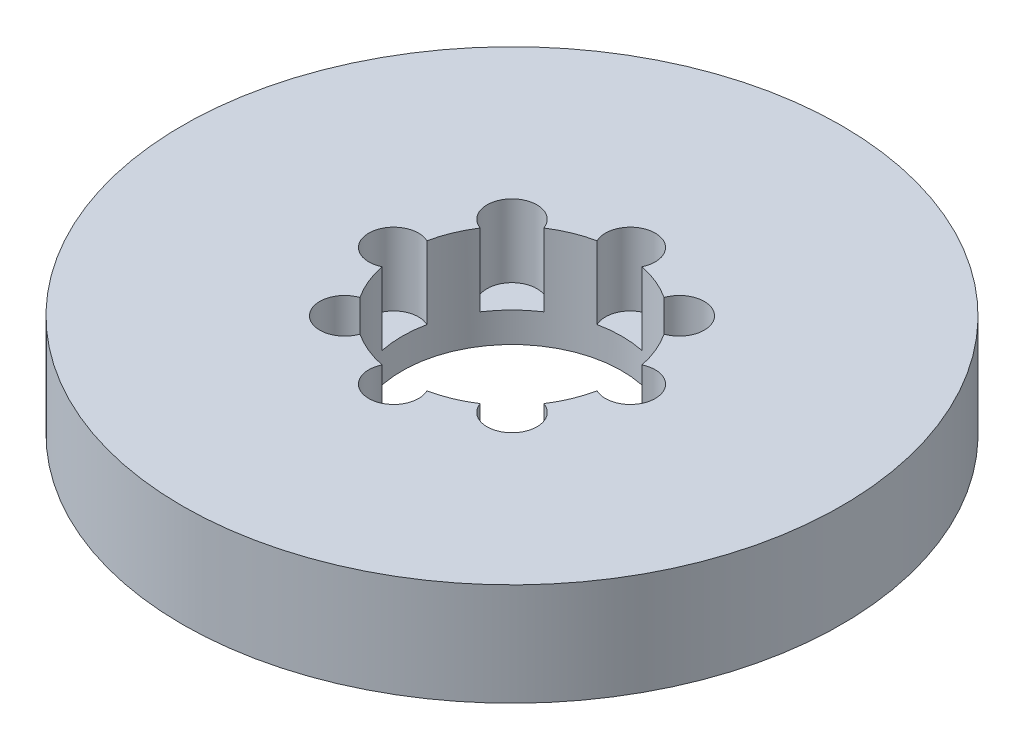
from build123d import *

# Parameters (mm, degrees)
SKETCH1_R           = 90
BOSS_EXTRUDE1_DEPTH = 28
SKETCH2_R           = 30
CUT_EXTRUDE1_DEPTH  = 131.322676461
SKETCH3_R           = 6.809141397
CUT_EXTRUDE2_DEPTH  = 19.825508394
CIRPATTERN1_COUNT   = 8


with BuildPart() as part:
    # Sketch1 → Boss-Extrude1 (new body)
    with BuildSketch(Plane(origin=(0, 0, 0), x_dir=(1, 0, 0), z_dir=(0, 1, 0))):
        Circle(SKETCH1_R)
    extrude(amount=BOSS_EXTRUDE1_DEPTH)

    # Sketch2 → Cut-Extrude1 (cut, through all)
    with BuildSketch(Plane(origin=(0, 0, 0), x_dir=(1, 0, 0), z_dir=(0, 1, 0))):
        Circle(SKETCH2_R)
    extrude(amount=CUT_EXTRUDE1_DEPTH, mode=Mode.SUBTRACT)

    # Sketch3 → Cut-Extrude2 (cut)
    with BuildSketch(Plane(origin=(0, 28, 0), x_dir=(1, 0, 0), z_dir=(0, 1, 0))):
        with Locations((-32.312841207, 0)):
            Circle(SKETCH3_R)
    cut_extrude2 = extrude(amount=-CUT_EXTRUDE2_DEPTH, mode=Mode.SUBTRACT)

    # CirPattern1: Cut-Extrude2 ×8 about axis
    cirpattern1_axis = Axis((0, 0, 0), (0, 1, 0))
    for i in range(1, CIRPATTERN1_COUNT):
        add(cut_extrude2.rotate(cirpattern1_axis, i * 360 / CIRPATTERN1_COUNT), mode=Mode.SUBTRACT)


solid = part.part
